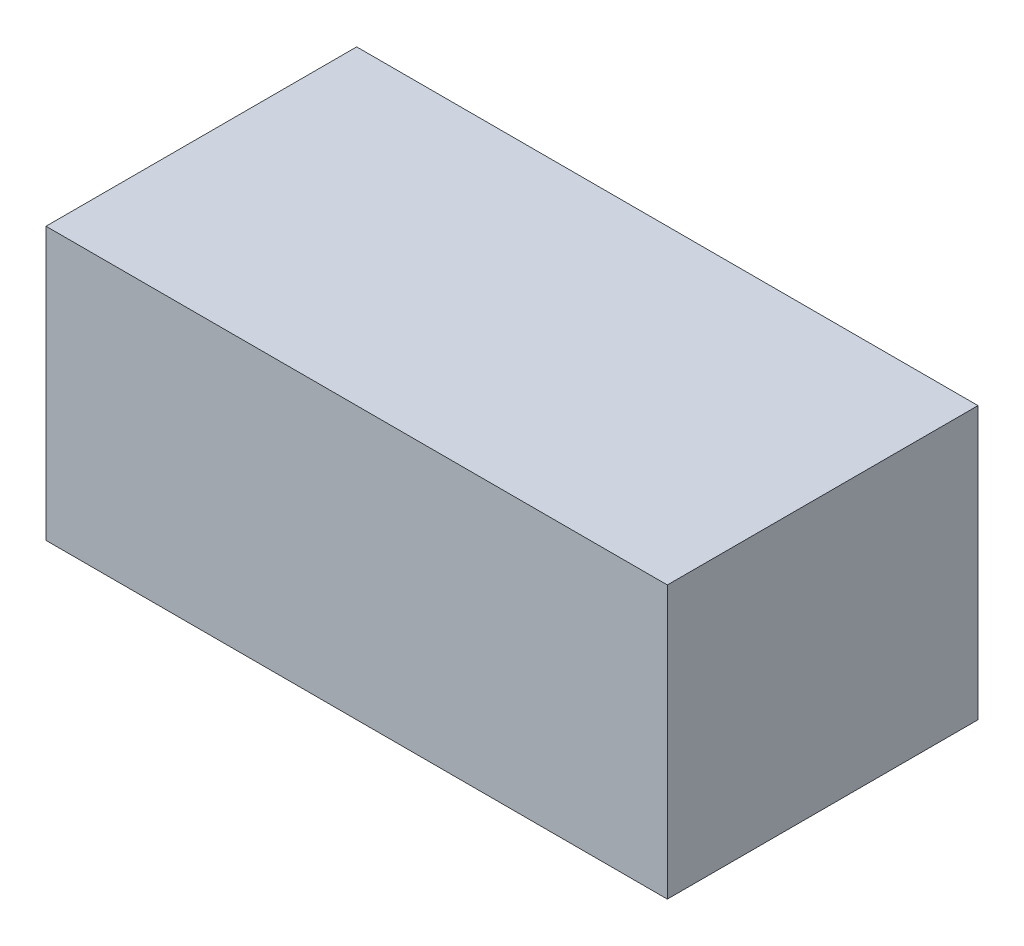
from build123d import *

# Parameters (mm, degrees)
SKETCH4_W           = 290
SKETCH4_H           = 145
BOSS_EXTRUDE3_DEPTH = 127
SKETCH5_W           = 286
SKETCH5_H           = 141
CUT_EXTRUDE2_DEPTH  = 126.8


with BuildPart() as part:
    # Sketch4 → Boss-Extrude3 (new body)
    with BuildSketch(Plane(origin=(0, 0, 0), x_dir=(1, 0, 0), z_dir=(0, 1, 0))):
        Rectangle(SKETCH4_W, SKETCH4_H)
    extrude(amount=BOSS_EXTRUDE3_DEPTH)

    # Sketch5 → Cut-Extrude2 (cut)
    with BuildSketch(Plane(origin=(0, 0, 0), x_dir=(1, 0, 0), z_dir=(0, 1, 0))):
        Rectangle(SKETCH5_W, SKETCH5_H)
    extrude(amount=CUT_EXTRUDE2_DEPTH, mode=Mode.SUBTRACT)


solid = part.part
